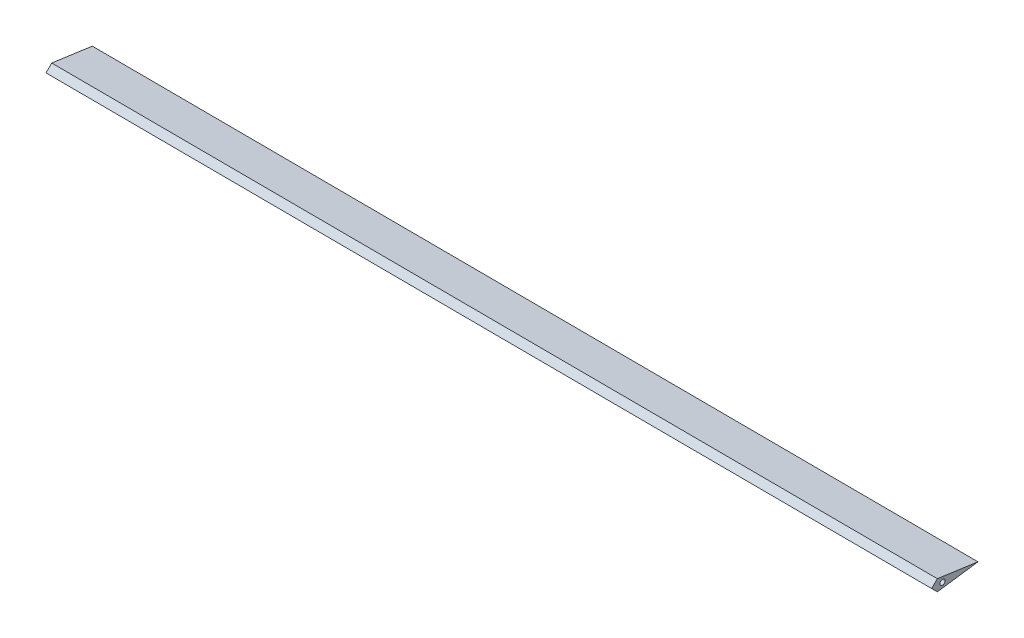
from build123d import *

# Parameters (mm, degrees)
AILERON_DEPTH           = 470.279242839
CUT_EXTRUDE2_DEPTH      = 474.191436132
CUT_EXTRUDE2_DEPTH_BACK = 474.191436132
SKETCH2_R               = 2.75


with BuildPart() as part:
    # aileron_root → aileron (new, symmetric, along a direction that is not the sketch's normal)
    with BuildSketch(Plane(origin=(0, 0, 0), x_dir=(0, 0, -1), z_dir=(1, 0, 0))):
        Polygon((-50, -7.018244417), (-50, 7.018244417), (0, 0), align=None)
    extrude(amount=AILERON_DEPTH, dir=(0.9999911087323262, 0, 0.004216924980718459), both=True)

    # Sketch2 → Cut-Extrude2 (cut, two sides: drawn at the far end of the back side and taken through both)
    with BuildSketch(Plane(origin=(0, 0, 0), x_dir=(-0.004216924980718461, 0, 0.9999911087323262), z_dir=(-0.9999911087323262, 0, -0.004216924980718461)).offset(-CUT_EXTRUDE2_DEPTH_BACK)):
        with Locations((37.5, 0)):
            Circle(SKETCH2_R)
        Polygon((48.999555437, 0), (41.98131102, -7.018244417), (49.999555437, -7.018244417), (49.999555437, 7.018244417), (41.98131102, 7.018244417), align=None)
    extrude(amount=CUT_EXTRUDE2_DEPTH + CUT_EXTRUDE2_DEPTH_BACK, mode=Mode.SUBTRACT)


solid = part.part
